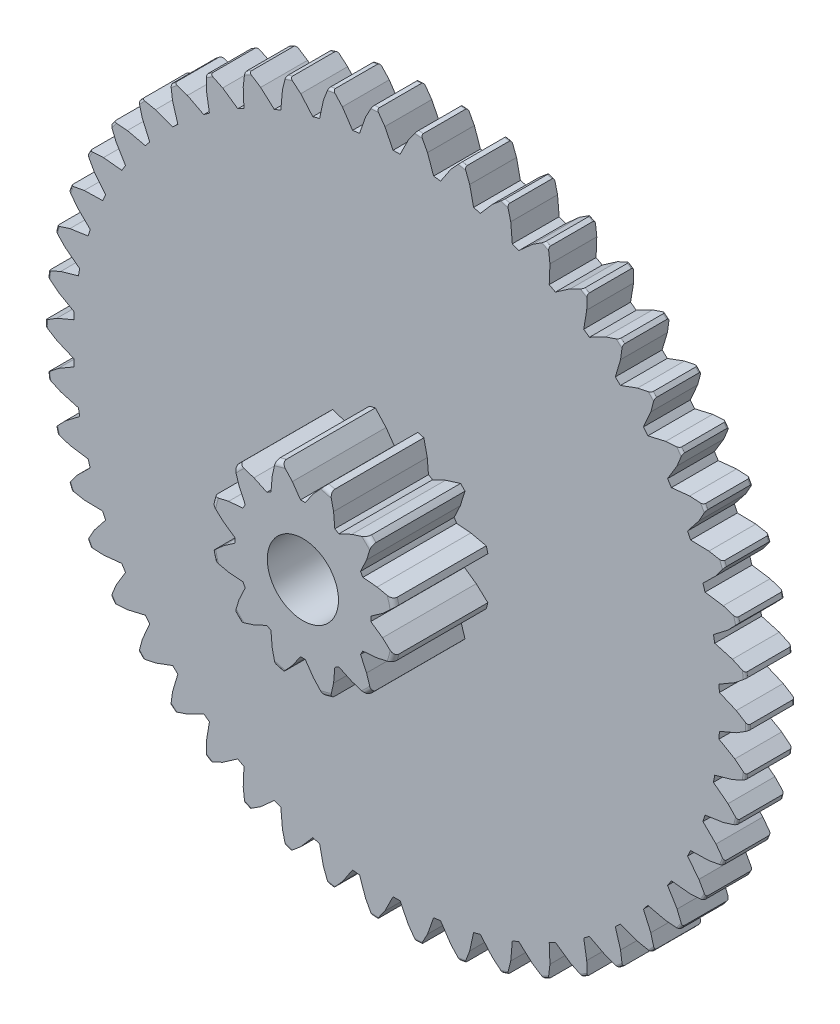
from build123d import *

# Parameters (mm, degrees)
CROQUIS1_R              = 7.5
SALIENTE_EXTRUIR1_DEPTH = 1
CROQUIS3_R              = 2
SALIENTE_EXTRUIR2_DEPTH = 2
CORTAR_EXTRUIR5_DEPTH   = 3
REDONDEO2_R             = 0.05
MATRIZC3_COUNT          = 50
CORTAR_EXTRUIR6_START   = -2
CORTAR_EXTRUIR6_DEPTH   = 2
REDONDEO1_R             = 0.1
MATRIZC4_COUNT          = 12
CROQUIS5_4_R            = 0.76
CORTAR_EXTRUIR8_DEPTH   = 3


with BuildPart() as part:
    # Croquis1 → Saliente-Extruir1 (new body)
    with BuildSketch(Plane.XY):
        Circle(CROQUIS1_R)
    extrude(amount=SALIENTE_EXTRUIR1_DEPTH)

    # Croquis3 → Saliente-Extruir2 (add)
    with BuildSketch(Plane.XY.offset(1)):
        Circle(CROQUIS3_R)
    extrude(amount=SALIENTE_EXTRUIR2_DEPTH)

    # Croquis4 → Cortar-Extruir5 (cut)
    with BuildSketch(Plane.XY.offset(3)):
        with BuildLine():
            Line((0.5, 7.6), (-0.5, 7.6))
            Line((-0.5, 7.6), (-0.25, 7.25))
            Line((-0.25, 7.25), (-0.075, 6.899592379))
            ThreePointArc((-0.075, 6.899592379), (0, 6.9), (0.075, 6.899592379))
            Line((0.075, 6.899592379), (0.25, 7.25))
            Line((0.25, 7.25), (0.5, 7.6))
        make_face()
    cortar_extruir5 = extrude(amount=-CORTAR_EXTRUIR5_DEPTH, mode=Mode.SUBTRACT)

    # Redondeo2
    redondeo2_edges = [part.edges().sort_by_distance(p)[0] for p in [
        (0, -7.5, 1),
        (0, -7.5, 0),
    ]]
    fillet(redondeo2_edges, radius=REDONDEO2_R)

    # MatrizC3: Cortar-Extruir5 ×50 about axis
    matrizc3_axis = Axis((0, 0, 0), (0, 0, 1))
    for i in range(1, MATRIZC3_COUNT):
        add(cortar_extruir5.rotate(matrizc3_axis, i * 360 / MATRIZC3_COUNT), mode=Mode.SUBTRACT)

    # Croquis5 → Cortar-Extruir6 (cut)
    with BuildSketch(Plane.XY.offset(3).offset(CORTAR_EXTRUIR6_START)):
        with BuildLine():
            Line((0, 2), (0, 1.45))
            ThreePointArc((0, 1.45), (0.025003718, 1.449784403), (0.05, 1.449137675))
            Line((0.05, 1.449137675), (0.225, 1.7))
            Line((0.225, 1.7), (0.452467288, 1.948146132))
            ThreePointArc((0.452467288, 1.948146132), (0.227714443, 1.986994246), (0, 2))
        make_face()
        with BuildLine():
            ThreePointArc((-0.05, 1.449137675), (-0.025003718, 1.449784403), (0, 1.45))
            Line((0, 1.45), (0, 2))
            ThreePointArc((0, 2), (-0.227714443, 1.986994246), (-0.452467288, 1.948146132))
            Line((-0.452467288, 1.948146132), (-0.225, 1.7))
            Line((-0.225, 1.7), (-0.05, 1.449137675))
        make_face()
    cortar_extruir6 = extrude(amount=CORTAR_EXTRUIR6_DEPTH, mode=Mode.SUBTRACT)

    # Redondeo1
    redondeo1_edges = [part.edges().sort_by_distance(p)[0] for p in [
        (0, -2, 3),
    ]]
    fillet(redondeo1_edges, radius=REDONDEO1_R)

    # MatrizC4: Cortar-Extruir6 ×12 about axis
    matrizc4_axis = Axis((0, 0, 0), (0, 0, 1))
    for i in range(1, MATRIZC4_COUNT):
        add(cortar_extruir6.rotate(matrizc4_axis, i * 360 / MATRIZC4_COUNT), mode=Mode.SUBTRACT)

    # Croquis5<4> → Cortar-Extruir8 (cut)
    with BuildSketch(Plane.XY.offset(3)):
        Circle(CROQUIS5_4_R)
    extrude(amount=-CORTAR_EXTRUIR8_DEPTH, mode=Mode.SUBTRACT)


solid = part.part
